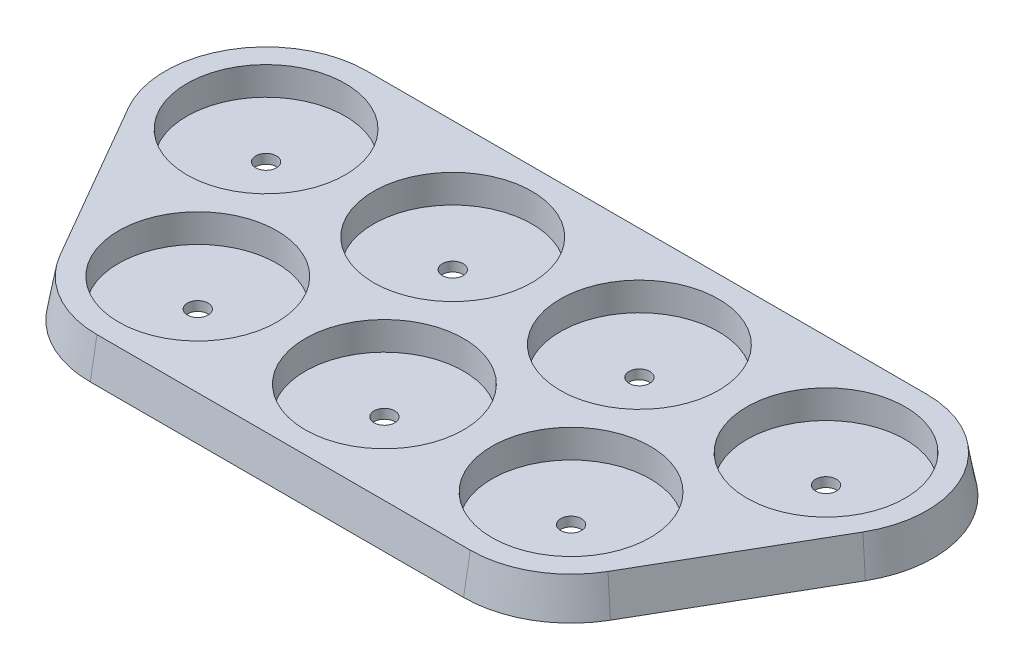
from build123d import *

# Parameters (mm, degrees)
BOSS_EXTRUDE1_DEPTH = 4
BOSS_EXTRUDE1_DRAFT = 10
CUT_EXTRUDE1_START  = 4
SKETCH1_3_R         = 1.1
CUT_EXTRUDE1_DEPTH  = 4
CUT_EXTRUDE2_START  = 4
SKETCH1_4_R         = 8.4
SKETCH1_4_R_2       = 1.1
CUT_EXTRUDE2_DEPTH  = 3


# Read off the part's stored shape, not the designer's step: Boss-Extrude1
with BuildPart() as part:
    # Boss-Extrude1 outline → Boss-Extrude1 (with draft: the straight prism first)
    with BuildSketch(Plane(origin=(0, 4, 0), x_dir=(1, 0, 0), z_dir=(0, 1, 0))):
        with BuildLine():
            ThreePointArc((-58.761875024, -22.494649034), (-54.847346039, -26.409178019), (-49.5, -27.841995072))
            Line((-49.5, -27.841995072), (-9.9, -27.841995072))
            ThreePointArc((-9.9, -27.841995072), (-4.552653961, -26.409178019), (-0.638124976, -22.494649034))
            Line((-0.638124976, -22.494649034), (9.261875024, -5.347346039))
            ThreePointArc((9.261875024, -5.347346039), (9.261875024, 5.347346039), (0, 10.694692077))
            Line((0, 10.694692077), (-59.4, 10.694692077))
            ThreePointArc((-59.4, 10.694692077), (-68.661875024, 5.347346039), (-68.661875024, -5.347346039))
            Line((-68.661875024, -5.347346039), (-58.761875024, -22.494649034))
        make_face()
    extrude(amount=-BOSS_EXTRUDE1_DEPTH)
    # Boss-Extrude1: the draft: its side faces are tilted about the plane it starts from
    boss_extrude1_sides = [part.faces().sort_by_distance(p)[0] for p in [
        (-68.661875024, 2, -5.347346038),
        (-63.711875024, 2, 13.920997536),
        (-54.847346038, 2, 26.409178019),
        (-29.7, 2, 27.841995072),
        (-4.552653962, 2, 26.409178019),
        (4.311875024, 2, 13.920997536),
        (9.261875024, 2, -5.347346038),
        (-29.7, 2, -10.694692077),
    ]]
    draft(boss_extrude1_sides, Plane(origin=(0, 4, 0), x_dir=(1, 0, 0), z_dir=(0, 1, 0)), BOSS_EXTRUDE1_DRAFT)

    # Sketch1<3> → Cut-Extrude1 (cut)
    with BuildSketch(Plane(origin=(0, 0, 0), x_dir=(1, 0, 0), z_dir=(0, 1, 0)).offset(CUT_EXTRUDE1_START)):
        with Locations(Location((-9.9, -17.147302995, 0), (0, 0, 270))):
            Circle(SKETCH1_3_R)
        with Locations(Location((0, 0, 0), (0, 0, 270))):
            Circle(SKETCH1_3_R)
        with Locations(Location((-29.7, -17.147302995, 0), (0, 0, 270))):
            Circle(SKETCH1_3_R)
        with Locations(Location((-39.6, 0, 0), (0, 0, 270))):
            Circle(SKETCH1_3_R)
        with Locations(Location((-49.5, -17.147302995, 0), (0, 0, 270))):
            Circle(SKETCH1_3_R)
        with Locations(Location((-59.4, 0, 0), (0, 0, 270))):
            Circle(SKETCH1_3_R)
        with Locations(Location((-19.8, 0, 0), (0, 0, 270))):
            Circle(SKETCH1_3_R)
    extrude(amount=-CUT_EXTRUDE1_DEPTH, mode=Mode.SUBTRACT)

    # Sketch1<4> → Cut-Extrude2 (cut)
    # profile 1 of 7: a face of its own
    with BuildSketch(Plane(origin=(0, 0, 0), x_dir=(1, 0, 0), z_dir=(0, 1, 0)).offset(CUT_EXTRUDE2_START)):
        with Locations(Location((-19.8, 0, 0), (0, 0, 270))):
            Circle(SKETCH1_4_R)
        with Locations(Location((-19.8, 0, 0), (0, 0, 270))):
            Circle(SKETCH1_4_R_2, mode=Mode.SUBTRACT)
    # profile 2 of 7: a face of its own
    with BuildSketch(Plane(origin=(0, 0, 0), x_dir=(1, 0, 0), z_dir=(0, 1, 0)).offset(CUT_EXTRUDE2_START)):
        with Locations(Location((-9.9, -17.147302995, 0), (0, 0, 270))):
            Circle(SKETCH1_4_R)
        with Locations(Location((-9.9, -17.147302995, 0), (0, 0, 270))):
            Circle(SKETCH1_4_R_2, mode=Mode.SUBTRACT)
    # profile 3 of 7: a face of its own
    with BuildSketch(Plane(origin=(0, 0, 0), x_dir=(1, 0, 0), z_dir=(0, 1, 0)).offset(CUT_EXTRUDE2_START)):
        with Locations(Location((0, 0, 0), (0, 0, 270))):
            Circle(SKETCH1_4_R)
        with Locations(Location((0, 0, 0), (0, 0, 270))):
            Circle(SKETCH1_4_R_2, mode=Mode.SUBTRACT)
    # profile 4 of 7: a face of its own
    with BuildSketch(Plane(origin=(0, 0, 0), x_dir=(1, 0, 0), z_dir=(0, 1, 0)).offset(CUT_EXTRUDE2_START)):
        with Locations(Location((-29.7, -17.147302995, 0), (0, 0, 270))):
            Circle(SKETCH1_4_R)
        with Locations(Location((-29.7, -17.147302995, 0), (0, 0, 270))):
            Circle(SKETCH1_4_R_2, mode=Mode.SUBTRACT)
    # profile 5 of 7: a face of its own
    with BuildSketch(Plane(origin=(0, 0, 0), x_dir=(1, 0, 0), z_dir=(0, 1, 0)).offset(CUT_EXTRUDE2_START)):
        with Locations(Location((-39.6, 0, 0), (0, 0, 270))):
            Circle(SKETCH1_4_R)
        with Locations(Location((-39.6, 0, 0), (0, 0, 270))):
            Circle(SKETCH1_4_R_2, mode=Mode.SUBTRACT)
    # profile 6 of 7: a face of its own
    with BuildSketch(Plane(origin=(0, 0, 0), x_dir=(1, 0, 0), z_dir=(0, 1, 0)).offset(CUT_EXTRUDE2_START)):
        with Locations(Location((-49.5, -17.147302995, 0), (0, 0, 270))):
            Circle(SKETCH1_4_R)
        with Locations(Location((-49.5, -17.147302995, 0), (0, 0, 270))):
            Circle(SKETCH1_4_R_2, mode=Mode.SUBTRACT)
    # profile 7 of 7: a face of its own
    with BuildSketch(Plane(origin=(0, 0, 0), x_dir=(1, 0, 0), z_dir=(0, 1, 0)).offset(CUT_EXTRUDE2_START)):
        with Locations(Location((-59.4, 0, 0), (0, 0, 270))):
            Circle(SKETCH1_4_R)
        with Locations(Location((-59.4, 0, 0), (0, 0, 270))):
            Circle(SKETCH1_4_R_2, mode=Mode.SUBTRACT)
    extrude(amount=-CUT_EXTRUDE2_DEPTH, mode=Mode.SUBTRACT)


solid = part.part
